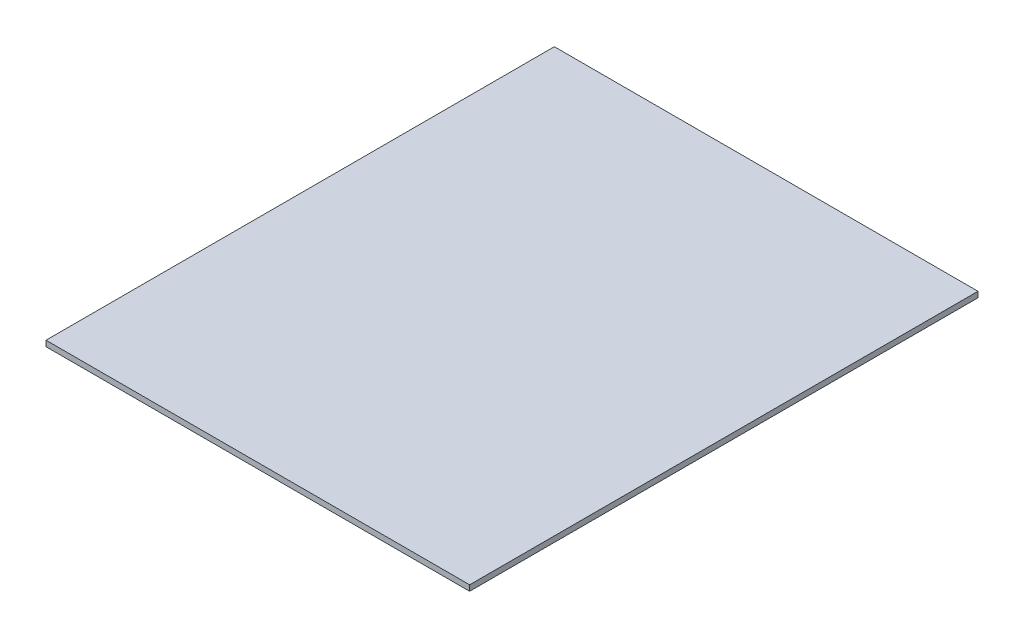
from build123d import *

# Parameters (mm, degrees)
SKETCH1_W           = 150
SKETCH1_H           = 180
BOSS_EXTRUDE1_DEPTH = 2


with BuildPart() as part:
    # Sketch1 → Boss-Extrude1 (new body)
    with BuildSketch(Plane(origin=(0, 0, 0), x_dir=(1, 0, 0), z_dir=(0, 1, 0))):
        with Locations((4.790568177, -15.946250866)):
            Rectangle(SKETCH1_W, SKETCH1_H)
    extrude(amount=BOSS_EXTRUDE1_DEPTH)


solid = part.part
